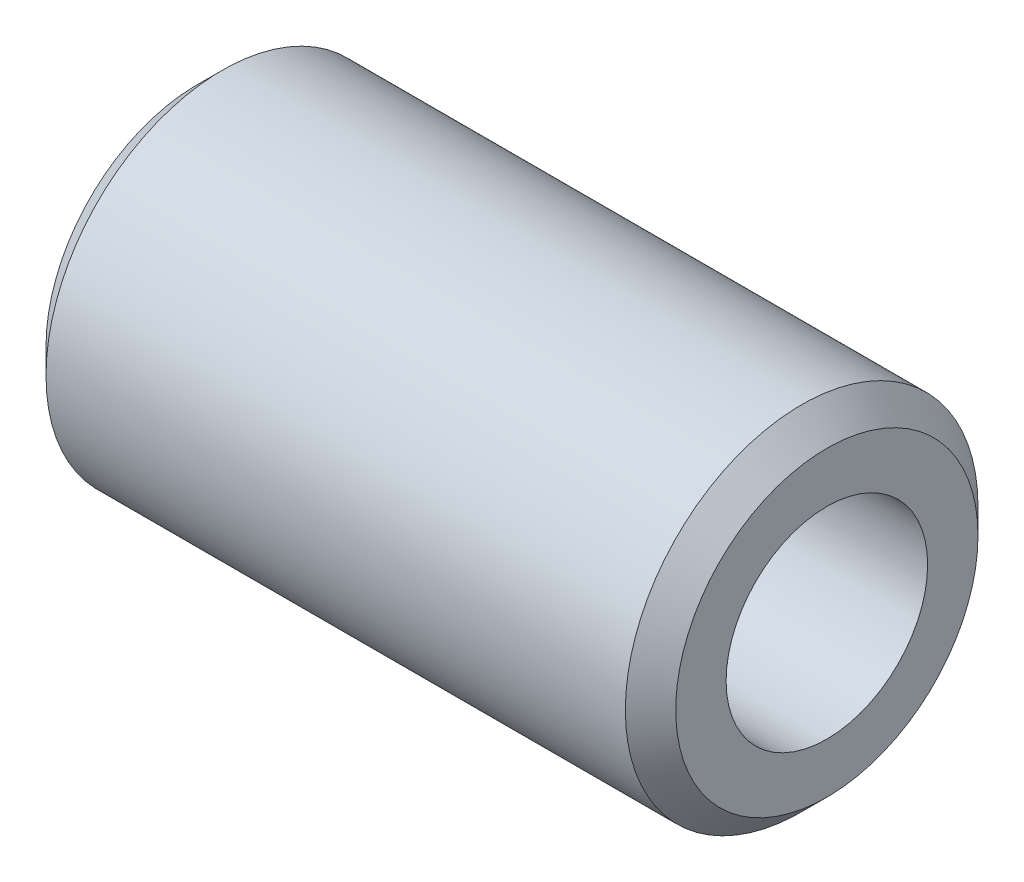
from build123d import *

# Parameters (mm, degrees)
SKETCH_1_W                      = 25
SKETCH_1_H                      = 3
HOLE_WIZARD_8_0_8_1_D           = 8
HOLE_WIZARD_8_0_8_1_DEPTH       = 5
HOLE_WIZARD_8_0_8_1_CSINK_D     = 8.05
HOLE_WIZARD_8_0_8_1_CSINK_ANGLE = 90
HOLE_WIZARD_8_0_8_1_TIP         = 2.403442476
SKETCH_3_W                      = 15
SKETCH_3_H                      = 5
CUT_EXTRUDE_1_DEPTH             = 4
FILLET_1_R                      = 2.5
CHAMFER_1_SIZE                  = 1


with BuildPart() as part:
    # Эскиз1 → Повернуть1 (revolve)
    with BuildSketch(Plane.XY, mode=Mode.PRIVATE) as revolve_1_sk:
        with Locations((0, 5.5)):
            Rectangle(SKETCH_1_W, SKETCH_1_H)
    revolve(revolve_1_sk.sketch.rotate(Axis((0, 0, 0), (-1, 0, 0)), 90), axis=Axis((0, 0, 0), (-1, 0, 0)))

    # Диаметр отверстия Ø8.0 (8)1
    with Locations(Plane.ZY.offset(12.5)):
        with Locations((0, 0)):
            CounterSinkHole(HOLE_WIZARD_8_0_8_1_D / 2, HOLE_WIZARD_8_0_8_1_CSINK_D / 2, depth=HOLE_WIZARD_8_0_8_1_DEPTH, counter_sink_angle=HOLE_WIZARD_8_0_8_1_CSINK_ANGLE)
            with Locations((0, 0, -(HOLE_WIZARD_8_0_8_1_DEPTH + HOLE_WIZARD_8_0_8_1_TIP / 2))):  # 118° drill point
                Cone(0, HOLE_WIZARD_8_0_8_1_D / 2, HOLE_WIZARD_8_0_8_1_TIP, mode=Mode.SUBTRACT)

    # Эскиз3 → Вырез-Вытянуть1 (cut)
    with BuildSketch(Plane(origin=(0, -7, 0), x_dir=(-1, 0, 0), z_dir=(0, -1, 0))):
        Rectangle(SKETCH_3_W, SKETCH_3_H)
    extrude(amount=-CUT_EXTRUDE_1_DEPTH, mode=Mode.SUBTRACT)

    # Скругление1
    fillet_1_edges = [part.edges().sort_by_distance(p)[0] for p in [
        (-7.5, -4.830423707, 2.5),
        (-7.5, -4.830423707, -2.5),
        (7.5, -4.830423707, 2.5),
        (7.5, -4.830423707, -2.5),
    ]]
    fillet(fillet_1_edges, radius=FILLET_1_R - 0.0001)  # a hair under: the kernel refuses the full size

    # Фаска1
    chamfer_1_edges = [part.edges().sort_by_distance(p)[0] for p in [
        (12.5, 0, 7),
        (-12.5, 0, 7),
    ]]
    chamfer(chamfer_1_edges, length=CHAMFER_1_SIZE)


solid = part.part
